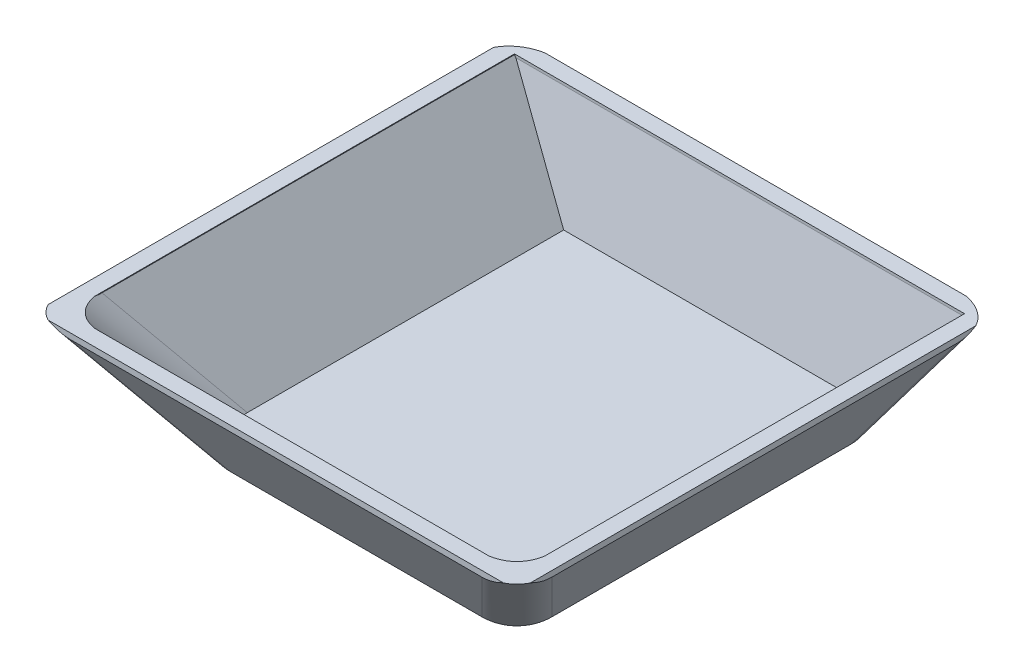
from build123d import *

# Parameters (mm, degrees)
SKETCH1_W            = 5.409999999999997
SKETCH1_H            = 5.409999999999997
SKETCH1_W_2          = 4.549942703341507
SKETCH1_H_2          = 4.549942703341509
SKETCH1_W_3          = 0.4399999999999977
BOSS_EXTRUDE8_DEPTH  = 8.9
SKETCH2_W            = 0.24999999999999645
SKETCH2_H            = 1.5849393526398075
SKETCH2_W_2          = 0.25
CUT_EXTRUDE1_DEPTH   = 1
SKETCH3_W            = 2.0000000000000036
SKETCH3_H            = 0.1681942632906388
BOSS_EXTRUDE9_DEPTH  = 0.44
BOSS_EXTRUDE10_DEPTH = 2
SKETCH6_W            = 3.0119840570828487
SKETCH6_H            = 5.999459520470431
CUT_EXTRUDE2_DEPTH   = 10
SKETCH8_W            = 9
SKETCH8_H            = 17.909999999999997
BOSS_EXTRUDE11_DEPTH = 4.5
CHAMFER3_SIZE        = 3
CHAMFER3_SIZE2       = 4.2844440202263625
CHAMFER4_SIZE        = 1
CHAMFER4_SIZE2       = 4.331475874284207
SKETCH12_W           = 8.408099926910044
SKETCH12_H           = 4.631365679829861
CUT_EXTRUDE3_DEPTH   = 30
SHELL6_T             = -0.6
FILLET1_R            = 1.6
FILLET4_R            = 1.6


# Read off the part's stored shape, not the designer's step: Mirror5
with BuildPart() as part:
    # Sketch1 → Boss-Extrude8 (new body)
    # profile 1 of 10: a face of its own
    with BuildSketch(Plane(origin=(0, 0, 0), x_dir=(1, 0, 0), z_dir=(0, 1, 0))):
        with Locations((-39.80770033929644, 14.55082776302726)):
            Rectangle(SKETCH1_W, SKETCH1_H)
        with Locations((-39.79772898762569, 14.560799114698018)):
            Rectangle(SKETCH1_W_2, SKETCH1_H_2, mode=Mode.SUBTRACT)
    # profile 2 of 10: a face of its own
    with BuildSketch(Plane(origin=(0, 0, 0), x_dir=(1, 0, 0), z_dir=(0, 1, 0))):
        with Locations((-39.80770033929644, 14.560799114698018)):
            Rectangle(SKETCH1_W_3, SKETCH1_H_2)
    # profile 3 of 10: a face of its own
    with BuildSketch(Plane(origin=(0, 0, 0), x_dir=(1, 0, 0), z_dir=(0, 1, 0))):
        with BuildLine():
            ThreePointArc((-42.09264304263795, 17.25582776302726), (-42.302671690967195, 17.47082776302726), (-42.51270033929644, 17.25582776302726))
            Line((-42.51270033929644, 17.25582776302726), (-42.09264304263795, 17.25582776302726))
        make_face()
    # profile 4 of 10: a face of its own
    with BuildSketch(Plane(origin=(0, 0, 0), x_dir=(1, 0, 0), z_dir=(0, 1, 0))):
        with BuildLine():
            ThreePointArc((-42.51270033929644, 17.255827763027263), (-42.72270033929644, 17.035827763027264), (-42.51270033929644, 16.815827763027265))
            Line((-42.51270033929644, 16.815827763027265), (-42.51270033929644, 17.25582776302726))
        make_face()
    # profile 5 of 10: a face of its own
    with BuildSketch(Plane(origin=(0, 0, 0), x_dir=(1, 0, 0), z_dir=(0, 1, 0))):
        with BuildLine():
            ThreePointArc((-42.51270033929644, 12.285827763027262), (-42.722700339296445, 12.065827763027261), (-42.51270033929644, 11.84582776302726))
            Line((-42.51270033929644, 11.845827763027263), (-42.51270033929644, 12.285827763027262))
        make_face()
    # profile 6 of 10: a face of its own
    with BuildSketch(Plane(origin=(0, 0, 0), x_dir=(1, 0, 0), z_dir=(0, 1, 0))):
        with BuildLine():
            Line((-42.09264304263795, 11.845827763027263), (-42.51270033929644, 11.845827763027263))
            ThreePointArc((-42.51270033929644, 11.845827763027263), (-42.302671690967195, 11.630827763027263), (-42.09264304263795, 11.845827763027263))
        make_face()
    # profile 7 of 10: a face of its own
    with BuildSketch(Plane(origin=(0, 0, 0), x_dir=(1, 0, 0), z_dir=(0, 1, 0))):
        with BuildLine():
            Line((-37.10270033929644, 11.845827763027263), (-37.522757635954925, 11.845827763027263))
            ThreePointArc((-37.522757635954925, 11.845827763027263), (-37.31272898762568, 11.630827763027263), (-37.10270033929644, 11.845827763027263))
        make_face()
    # profile 8 of 10: a face of its own
    with BuildSketch(Plane(origin=(0, 0, 0), x_dir=(1, 0, 0), z_dir=(0, 1, 0))):
        with BuildLine():
            Line((-37.10270033929644, 12.285827763027264), (-37.10270033929644, 11.845827763027263))
            ThreePointArc((-37.10270033929644, 11.845827763027259), (-36.89270033929645, 12.065827763027261), (-37.10270033929644, 12.285827763027264))
        make_face()
    # profile 9 of 10: a face of its own
    with BuildSketch(Plane(origin=(0, 0, 0), x_dir=(1, 0, 0), z_dir=(0, 1, 0))):
        with BuildLine():
            ThreePointArc((-37.10270033929644, 17.25582776302726), (-37.31272898762568, 17.47082776302726), (-37.522757635954925, 17.25582776302726))
            Line((-37.522757635954925, 17.25582776302726), (-37.10270033929644, 17.25582776302726))
        make_face()
    # profile 10 of 10: a face of its own
    with BuildSketch(Plane(origin=(0, 0, 0), x_dir=(1, 0, 0), z_dir=(0, 1, 0))):
        with BuildLine():
            Line((-37.10270033929644, 17.25582776302726), (-37.10270033929644, 16.815827763027265))
            ThreePointArc((-37.10270033929644, 16.815827763027265), (-36.89270033929645, 17.035827763027264), (-37.10270033929644, 17.255827763027263))
        make_face()
    extrude(amount=BOSS_EXTRUDE8_DEPTH)

    # Sketch2 → Cut-Extrude1 (cut)
    with BuildSketch(Plane(origin=(-37.10270033929644, 0, 0), x_dir=(0, 0, -1), z_dir=(1, 0, 0))):
        Polygon((13.55082776302726, 7.315060647360192), (13.300827763027263, 7.315060647360192), (13.300827763027263, 3.9000000000000004), (13.550827763027263, 3.9), align=None)
        with Locations((13.42582776302726, 8.107530323680097)):
            Rectangle(SKETCH2_W, SKETCH2_H)
        with Locations((15.675827763027263, 8.107530323680097)):
            Rectangle(SKETCH2_W_2, SKETCH2_H)
        Polygon((15.800827763027263, 7.315060647360192), (15.550827763027263, 7.315060647360192), (15.550827763027264, 3.9000000000000004), (15.800827763027263, 3.9), align=None)
    extrude(amount=-CUT_EXTRUDE1_DEPTH, mode=Mode.SUBTRACT)

    # Sketch3 → Boss-Extrude9 (add)
    with BuildSketch(Plane(origin=(-37.10270033929644, 0, 0), x_dir=(0, 0, -1), z_dir=(1, 0, 0))):
        with Locations((14.55082776302726, 6.984097131645319)):
            Rectangle(SKETCH3_W, SKETCH3_H)
    extrude(amount=BOSS_EXTRUDE9_DEPTH)

    # Sketch5 → Boss-Extrude10 (add)
    with BuildSketch(Plane.XY.offset(-13.55082776302726)):
        Polygon((-36.662700339296435, 7.068194263290638), (-37.10270033929644, 8.9), (-37.10270033929644, 7.068194263290638), align=None)
    extrude(amount=-BOSS_EXTRUDE10_DEPTH)

    # Sketch6 → Cut-Extrude2 (cut)
    with BuildSketch(Plane(origin=(0, 8.9, 0), x_dir=(1, 0, 0), z_dir=(0, 1, 0))):
        with Locations((-41.31369236783786, 14.541370123902443)):
            Rectangle(SKETCH6_W, SKETCH6_H)
    extrude(amount=-CUT_EXTRUDE2_DEPTH, mode=Mode.SUBTRACT)

    # Sketch8 → Boss-Extrude11 (add)
    with BuildSketch(Plane.XZ):
        with Locations((-35.30770033929644, -13.80082776302726)):
            Rectangle(SKETCH8_W, SKETCH8_H)
    extrude(amount=-BOSS_EXTRUDE11_DEPTH)

    # Chamfer3
    chamfer3_edges = [part.edges().sort_by_distance(p)[0] for p in [
        (-30.80770033929644, 0, -13.80082776302726),
        (-35.30770033929644, 0, -4.845827763027263),
    ]]
    chamfer3_side = [part.faces().sort_by_distance(p)[0] for p in [
        (-35.30770033929644, 0, -13.80082776302726),
    ]]
    chamfer(chamfer3_edges, length=CHAMFER3_SIZE, length2=CHAMFER3_SIZE2, reference=chamfer3_side[0])

    # Chamfer4
    chamfer4_edges = [part.edges().sort_by_distance(p)[0] for p in [
        (-36.80770033929644, 0, -22.75582776302726),
    ]]
    chamfer4_side = [part.faces().sort_by_distance(p)[0] for p in [
        (-36.80770033929644, 0, -15.300827763027259),
    ]]
    chamfer(chamfer4_edges, length=CHAMFER4_SIZE, length2=CHAMFER4_SIZE2, reference=chamfer4_side[0])

    # Sketch12 → Cut-Extrude3 (cut)
    with BuildSketch(Plane.ZY.offset(39.80770033929644)):
        with Locations((-13.543811608056215, 6.81568283991493)):
            Rectangle(SKETCH12_W, SKETCH12_H)
    extrude(amount=-CUT_EXTRUDE3_DEPTH, mode=Mode.SUBTRACT)

    # Shell6
    shell6_openings = [part.faces().sort_by_distance(p)[0] for p in [
        (-39.807700339, 2.347603862, -14.251531758),
        (-35.307700339, 4.5, -13.800827763),
    ]]
    offset(amount=SHELL6_T, openings=shell6_openings, kind=Kind.INTERSECTION)

    # Mirror5: part across plane


with BuildPart() as part_1:
    add(part.part)
    add(part.part.mirror(Plane(origin=(-39.80770033929644, -1.1000000000000003, -17.541099884137658), x_dir=(0, 0, 1), z_dir=(1, 0, 0))))

    # Fillet1
    # the kernel refuses this fillet: 1.6 mm, written as the material it takes off along each edge
    with BuildSketch(Plane(origin=(-35.22184592572937, -2.0196092005073596, -9.259973349460195), x_dir=(0.2853788331334057, 0.40756321170586113, -0.867439421552548), z_dir=(0.4975428121645219, 0.7105647754616313, 0.4975428121645219))) as fillet1_piece_1:
        with BuildLine():
            CenterArc((FILLET1_R * 0.710564775462, FILLET1_R), FILLET1_R, 199.20747972534394, 70.79252027465611)
            Line((-FILLET1_R * 0.233768654558, FILLET1_R * 0.671010071663), (0, 0))
            Line((0, 0), (FILLET1_R * 0.710564775462, -5e-17))
        make_face()
    extrude(amount=11.714150079890267, mode=Mode.SUBTRACT)
    with BuildSketch(Plane(origin=(-44.39355475286351, -2.0196092005073587, -9.259973349460195), x_dir=(0.8674394215525482, 0.40756321170586235, 0.2853788331334039), z_dir=(-0.4975428121645219, 0.7105647754616313, 0.4975428121645219))) as fillet1_piece_2:
        with BuildLine():
            CenterArc((FILLET1_R * 0.710564775462, FILLET1_R), FILLET1_R, 199.20747972534403, 70.792520274656)
            Line((-FILLET1_R * 0.233768654558, FILLET1_R * 0.671010071663), (0, 0))
            Line((0, 0), (FILLET1_R * 0.710564775462, 1e-17))
        make_face()
    extrude(amount=11.714150079890267, mode=Mode.SUBTRACT)
    with BuildSketch(Plane(origin=(-43.82767365962377, -2.8277711558707384, -21.102985351354345), x_dir=(-0.10658333920242485, 0.1522167834338588, 0.9825833515002738), z_dir=(-0.5635866571713927, 0.8048851610657796, -0.1858223811990618))) as fillet1_piece_3:
        with BuildLine():
            CenterArc((FILLET1_R * 0.87831509781, FILLET1_R), FILLET1_R, 187.41334827823792, 82.58665172176217)
            Line((-FILLET1_R * 0.11332603197, FILLET1_R * 0.870973375896), (0, 0))
            Line((0, 0), (FILLET1_R * 0.87831509781, -2e-17))
        make_face()
    extrude(amount=12.349570861520077, mode=Mode.SUBTRACT)
    with BuildSketch(Plane(origin=(-35.78772701896911, -2.8277711558707392, -21.102985351354345), x_dir=(0.10658333920242458, 0.15221678343385903, 0.9825833515002738), z_dir=(0.5635866571713927, 0.8048851610657796, -0.1858223811990618))) as fillet1_piece_4:
        with BuildLine():
            CenterArc((FILLET1_R * 0.87831509781, -FILLET1_R), FILLET1_R, 89.99999999999993, 82.58665172176215)
            Line((-FILLET1_R * 0.11332603197, -FILLET1_R * 0.870973375896), (0, 0))
            Line((0, 0), (FILLET1_R * 0.87831509781, -1e-17))
        make_face()
    extrude(amount=12.349570861520073, mode=Mode.SUBTRACT)

    # Fillet4
    # the kernel refuses this fillet: 1.6 mm, written as the material it adds along each edge
    with BuildSketch(Plane(origin=(-49.62184592572936, 6.4932324940611, -4.031682176594339), x_dir=(0.867439421552548, 0.40756321170586235, 0.28537883313340373), z_dir=(0.4975428121645219, -0.7105647754616313, -0.4975428121645219))) as fillet4_piece_1_section:
        with BuildLine():
            CenterArc((FILLET4_R * 0.710564775462, -FILLET4_R), FILLET4_R, 89.99999999999997, 70.79252027465614)
            Line((-FILLET4_R * 0.233768654558, -FILLET4_R * 0.671010071663), (0, 0))
            Line((0, 0), (FILLET4_R * 0.710564775462, -1e-17))
        make_face()
    fillet4_piece_1 = extrude(amount=11.13598924099177, mode=Mode.PRIVATE)
    fillet4_piece_1 = split(fillet4_piece_1, bisect_by=Plane(origin=(-46.579824148031086, 4.5, -7.073703954292618), z_dir=(0, -1, 0)), keep=Keep.TOP, mode=Mode.PRIVATE)
    fillet4_piece_1 = split(fillet4_piece_1, bisect_by=Plane(origin=(-46.579824148031086, 0.6, -7.073703954292618), z_dir=(0, 1, 0)), keep=Keep.TOP, mode=Mode.PRIVATE)
    add(fillet4_piece_1)
    with BuildSketch(Plane(origin=(-29.993554752863513, 6.4932324940611, -4.031682176594337), x_dir=(-0.867439421552548, 0.40756321170586274, 0.28537883313340323), z_dir=(-0.4975428121645219, -0.7105647754616313, -0.4975428121645219))) as fillet4_piece_2_section:
        with BuildLine():
            CenterArc((FILLET4_R * 0.710564775462, FILLET4_R), FILLET4_R, 199.20747972534394, 70.79252027465606)
            Line((-FILLET4_R * 0.233768654558, FILLET4_R * 0.671010071663), (0, 0))
            Line((0, 0), (FILLET4_R * 0.710564775462, -6e-17))
        make_face()
    fillet4_piece_2 = extrude(amount=11.13598924099177, mode=Mode.PRIVATE)
    fillet4_piece_2 = split(fillet4_piece_2, bisect_by=Plane(origin=(-33.035576530561805, 4.5, -7.07370395429263), z_dir=(0, -1, 0)), keep=Keep.TOP, mode=Mode.PRIVATE)
    fillet4_piece_2 = split(fillet4_piece_2, bisect_by=Plane(origin=(-33.035576530561805, 0.6, -7.07370395429263), z_dir=(0, 1, 0)), keep=Keep.TOP, mode=Mode.PRIVATE)
    add(fillet4_piece_2)


solid = part_1.part
